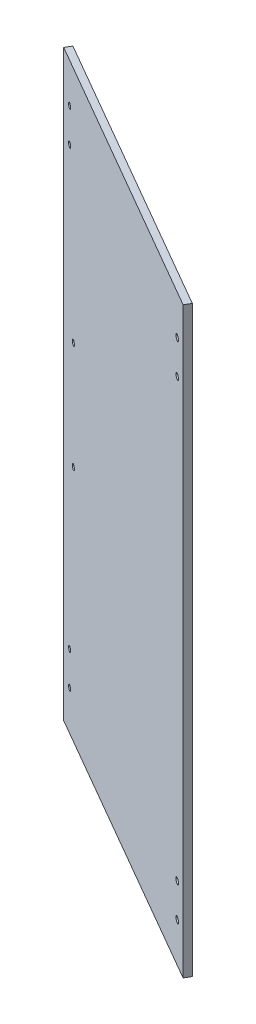
from build123d import *

# Parameters (mm, degrees)
STOCK_ACRYLIC_DOOR_MASTER_1_START     = 163.456714755
STOCK_ACRYLIC_DOOR_MASTER_1_OUTLINE_W = 243.269145362
STOCK_ACRYLIC_DOOR_MASTER_1_OUTLINE_H = 433.75
STOCK_ACRYLIC_DOOR_MASTER_1_OUTLINE_R = 2
STOCK_ACRYLIC_DOOR_MASTER_1_DEPTH     = 5
SKETCH1_W                             = 0.25
SKETCH1_H                             = 433.75
CUT_EXTRUDE1_DEPTH                    = 438.771536387


# Read off the part's stored shape, not the designer's step: Stock-acrylic-door-master-1
with BuildPart() as part:
    # Stock-acrylic-door-master-1 outline → Stock-acrylic-door-master-1 (new body)
    with BuildSketch(Plane(origin=(0, 0, 0), x_dir=(0.866025403784438, 0, 0.500000000000001), z_dir=(0.500000000000001, 0, -0.866025403784438)).offset(STOCK_ACRYLIC_DOOR_MASTER_1_START)):
        with Locations((0, -202.375)):
            Rectangle(STOCK_ACRYLIC_DOOR_MASTER_1_OUTLINE_W, STOCK_ACRYLIC_DOOR_MASTER_1_OUTLINE_H)
        with Locations((-109.384572681, -389.875)):
            Circle(STOCK_ACRYLIC_DOOR_MASTER_1_OUTLINE_R, mode=Mode.SUBTRACT)
        with Locations((-109.384572681, -364.875)):
            Circle(STOCK_ACRYLIC_DOOR_MASTER_1_OUTLINE_R, mode=Mode.SUBTRACT)
        with Locations((-101.634572681, -242.375)):
            Circle(STOCK_ACRYLIC_DOOR_MASTER_1_OUTLINE_R, mode=Mode.SUBTRACT)
        with BuildLine():
            Line((108.884572681, -387.875), (109.884572681, -387.875))
            ThreePointArc((109.884572681, -387.875), (111.884572681, -389.875), (109.884572681, -391.875))
            Line((109.884572681, -391.875), (108.884572681, -391.875))
            ThreePointArc((108.884572681, -391.875), (106.884572681, -389.875), (108.884572681, -387.875))
        make_face(mode=Mode.SUBTRACT)
        with BuildLine():
            Line((108.884572681, -362.875), (109.884572681, -362.875))
            ThreePointArc((109.884572681, -362.875), (111.884572681, -364.875), (109.884572681, -366.875))
            Line((109.884572681, -366.875), (108.884572681, -366.875))
            ThreePointArc((108.884572681, -366.875), (106.884572681, -364.875), (108.884572681, -362.875))
        make_face(mode=Mode.SUBTRACT)
        with Locations((-101.634572681, -162.375)):
            Circle(STOCK_ACRYLIC_DOOR_MASTER_1_OUTLINE_R, mode=Mode.SUBTRACT)
        with Locations((-109.384572681, -39.875)):
            Circle(STOCK_ACRYLIC_DOOR_MASTER_1_OUTLINE_R, mode=Mode.SUBTRACT)
        with Locations((-109.384572681, -14.875)):
            Circle(STOCK_ACRYLIC_DOOR_MASTER_1_OUTLINE_R, mode=Mode.SUBTRACT)
        with BuildLine():
            Line((108.884572681, -37.875), (109.884572681, -37.875))
            ThreePointArc((109.884572681, -37.875), (111.884572681, -39.875), (109.884572681, -41.875))
            Line((109.884572681, -41.875), (108.884572681, -41.875))
            ThreePointArc((108.884572681, -41.875), (106.884572681, -39.875), (108.884572681, -37.875))
        make_face(mode=Mode.SUBTRACT)
        with BuildLine():
            Line((108.884572681, -12.875), (109.884572681, -12.875))
            ThreePointArc((109.884572681, -12.875), (111.884572681, -14.875), (109.884572681, -16.875))
            Line((109.884572681, -16.875), (108.884572681, -16.875))
            ThreePointArc((108.884572681, -16.875), (106.884572681, -14.875), (108.884572681, -12.875))
        make_face(mode=Mode.SUBTRACT)
    extrude(amount=STOCK_ACRYLIC_DOOR_MASTER_1_DEPTH)

    # Sketch1 → Cut-Extrude1 (cut, through all)
    with BuildSketch(Plane(origin=(84.228357378, 0, -145.887794416), x_dir=(-0.866025403784438, 0, -0.5000000000000012), z_dir=(0.5000000000000011, 0, -0.8660254037844379))):
        with Locations((-121.509572681, 202.375)):
            Rectangle(SKETCH1_W, SKETCH1_H)
        with Locations((121.509572681, 202.375)):
            Rectangle(SKETCH1_W, SKETCH1_H)
    extrude(amount=-CUT_EXTRUDE1_DEPTH, mode=Mode.SUBTRACT)


solid = part.part
